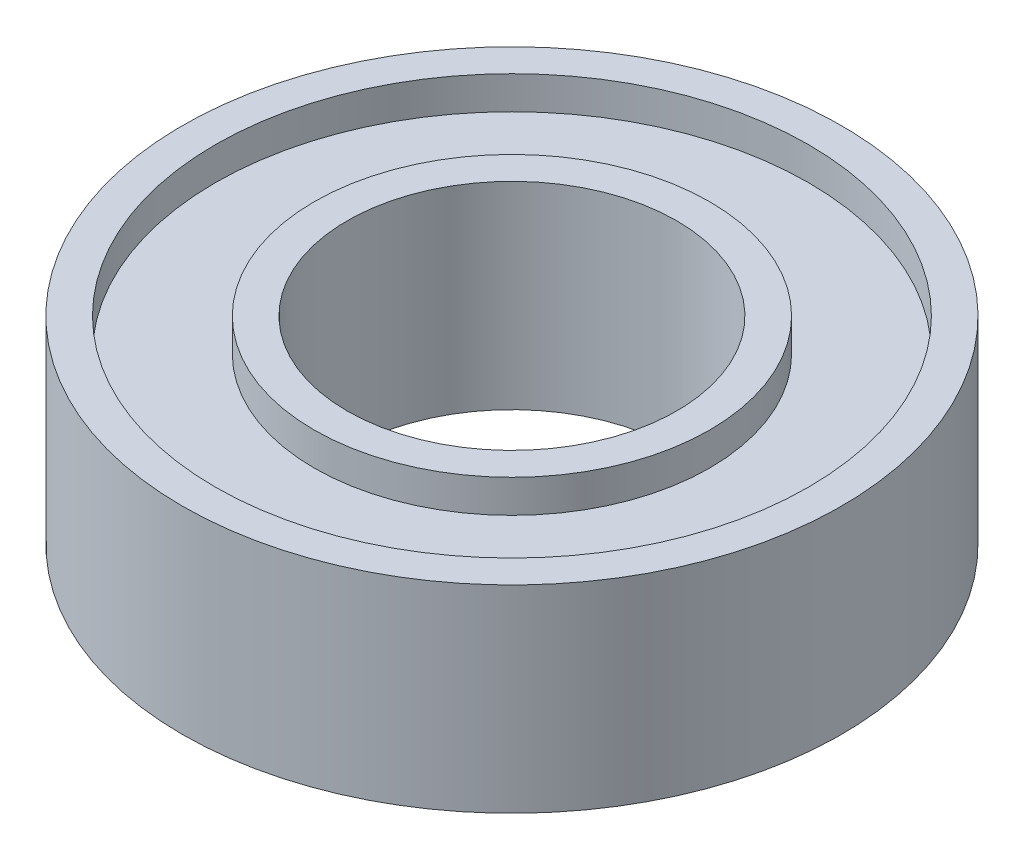
from build123d import *

# Parameters (mm, degrees)
SKETCH1_R            = 10
MAIN_EXTRUSION_DEPTH = 6
SKETCH2_R            = 5
ID_BORE_DEPTH        = 20
SKETCH3_R            = 9
SKETCH3_R_2          = 6
SEAL_RECESS_DEPTH    = 1


with BuildPart() as part:
    # Sketch1 → main extrusion (new body)
    with BuildSketch(Plane(origin=(0, 0, 0), x_dir=(1, 0, 0), z_dir=(0, 1, 0))):
        Circle(SKETCH1_R)
    extrude(amount=MAIN_EXTRUSION_DEPTH)

    # Sketch2 → ID bore (cut)
    with BuildSketch(Plane(origin=(0, 6, 0), x_dir=(1, 0, 0), z_dir=(0, 1, 0))):
        Circle(SKETCH2_R)
    extrude(amount=-ID_BORE_DEPTH, mode=Mode.SUBTRACT)

    # Sketch3 → seal recess (cut)
    with BuildSketch(Plane(origin=(0, 6, 0), x_dir=(1, 0, 0), z_dir=(0, 1, 0))):
        Circle(SKETCH3_R)
        Circle(SKETCH3_R_2, mode=Mode.SUBTRACT)
    extrude(amount=-SEAL_RECESS_DEPTH, mode=Mode.SUBTRACT)


solid = part.part
